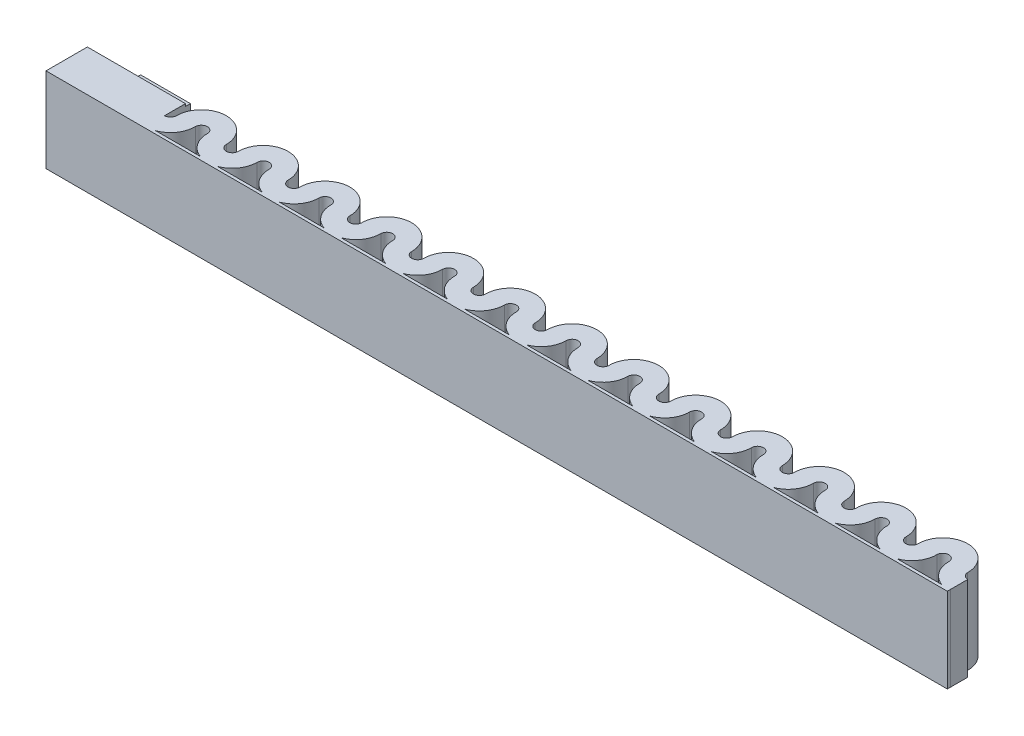
from build123d import *

# Parameters (mm, degrees)
BOSS_EXTRUDE1_DEPTH   = 15.8
BOSS_EXTRUDE1_2_DEPTH = 15.8
LPATTERN2_DEPTH       = 15.8
BOSS_EXTRUDE2_DEPTH   = 15.8
SKETCH7_W             = 19.688914994
SKETCH7_H             = 8
BOSS_EXTRUDE3_DEPTH   = 15.8
CUT_EXTRUDE1_START    = -15.8
CUT_EXTRUDE1_DEPTH    = 15.8
SKETCH9_R             = 2
CUT_EXTRUDE2_DEPTH    = 18
BOSS_EXTRUDE4_START   = 0.6
BOSS_EXTRUDE4_DEPTH   = 0.6
BOSS_EXTRUDE5_DEPTH   = 0.6
SKETCH12_W            = 180.889475192
SKETCH12_H            = 0.6
BOSS_EXTRUDE6_DEPTH   = 17
FILLET1_R             = 1
FILLET2_R             = 1
SKETCH13_W            = 10
SKETCH13_H            = 3
BOSS_EXTRUDE7_DEPTH   = 1


# Read off the part's stored shape, not the designer's step: LPattern2
with BuildPart() as part:
    # Sketch2 → Boss-Extrude1 (new body)
    with BuildSketch(Plane(origin=(0, 0, 0), x_dir=(1, 0, 0), z_dir=(0, 1, 0))):
        with BuildLine():
            Line((6.2, -1.2), (6.2, -1.8))
            ThreePointArc((6.2, -1.8), (4.927207794, -1.272792206), (4.4, 0))
            ThreePointArc((4.4, 0), (0, 4.4), (-4.4, 0))
            ThreePointArc((-4.4, 0), (-4.927207794, -1.272792206), (-6.2, -1.8))
            Line((-6.2, -1.8), (-6.2, -1.2))
            ThreePointArc((-6.2, -1.2), (-5.351471863, -0.848528137), (-5, 0))
            ThreePointArc((-5, 0), (0, 5), (5, 0))
            ThreePointArc((5, 0), (5.351471863, -0.848528137), (6.2, -1.2))
        make_face()
    extrude(amount=BOSS_EXTRUDE1_DEPTH)



with BuildPart() as body_2:
    # Sketch2 → Boss-Extrude1 2 (new body)
    with BuildSketch(Plane(origin=(0, 0, 0), x_dir=(1, 0, 0), z_dir=(0, 1, 0))):
        with BuildLine():
            Line((6.2, -4.4), (6.2, -5))
            ThreePointArc((6.2, -5), (2.664466094, -3.535533906), (1.2, 0))
            ThreePointArc((1.2, 0), (0, 1.2), (-1.2, 0))
            ThreePointArc((-1.2, 0), (-2.664466094, -3.535533906), (-6.2, -5))
            Line((-6.2, -5), (-6.2, -4.4))
            ThreePointArc((-6.2, -4.4), (-3.088730163, -3.111269837), (-1.8, 0))
            ThreePointArc((-1.8, 0), (0, 1.8), (1.8, 0))
            ThreePointArc((1.8, 0), (3.088730163, -3.111269837), (6.2, -4.4))
        make_face()
    extrude(amount=BOSS_EXTRUDE1_2_DEPTH)


with BuildPart() as part_1:
    add(part.part)

    add(body_2.part)  # LPattern2 merges body 2
    # LPattern2 outline → LPattern2 (add)
    with BuildSketch(Plane(origin=(0, 0, 0), x_dir=(1, 0, 0), z_dir=(0, 1, 0))):
        with BuildLine():
            ThreePointArc((6.2, -5), (9.735533906, -3.535533906), (11.2, 0))
            ThreePointArc((11.2, 0), (12.4, 1.2), (13.6, 0))
            ThreePointArc((13.6, 0), (18.6, -5), (23.6, 0))
            ThreePointArc((23.6, 0), (24.8, 1.2), (26, 0))
            ThreePointArc((26, 0), (31, -5), (36, 0))
            ThreePointArc((36, 0), (37.2, 1.2), (38.4, 0))
            ThreePointArc((38.4, 0), (43.4, -5), (48.4, 0))
            ThreePointArc((48.4, 0), (49.6, 1.2), (50.8, 0))
            ThreePointArc((50.8, 0), (55.8, -5), (60.8, 0))
            ThreePointArc((60.8, 0), (62, 1.2), (63.2, 0))
            ThreePointArc((63.2, 0), (68.2, -5), (73.2, 0))
            ThreePointArc((73.2, 0), (74.4, 1.2), (75.6, 0))
            ThreePointArc((75.6, 0), (80.6, -5), (85.6, 0))
            ThreePointArc((85.6, 0), (86.8, 1.2), (88, 0))
            ThreePointArc((88, 0), (93, -5), (98, 0))
            ThreePointArc((98, 0), (99.2, 1.2), (100.4, 0))
            ThreePointArc((100.4, 0), (105.4, -5), (110.4, 0))
            ThreePointArc((110.4, 0), (111.6, 1.2), (112.8, 0))
            ThreePointArc((112.8, 0), (117.8, -5), (122.8, 0))
            ThreePointArc((122.8, 0), (124, 1.2), (125.2, 0))
            ThreePointArc((125.2, 0), (130.2, -5), (135.2, 0))
            ThreePointArc((135.2, 0), (136.4, 1.2), (137.6, 0))
            ThreePointArc((137.6, 0), (142.6, -5), (147.6, 0))
            ThreePointArc((147.6, 0), (148.8, 1.2), (150, 0))
            ThreePointArc((150, 0), (151.464466094, -3.535533906), (155, -5))
            Line((155, -5), (155, -4.4))
            ThreePointArc((155, -4.4), (151.888730163, -3.111269837), (150.6, 0))
            ThreePointArc((150.6, 0), (148.8, 1.8), (147, 0))
            ThreePointArc((147, 0), (142.6, -4.4), (138.2, 0))
            ThreePointArc((138.2, 0), (136.4, 1.8), (134.6, 0))
            ThreePointArc((134.6, 0), (130.2, -4.4), (125.8, 0))
            ThreePointArc((125.8, 0), (124, 1.8), (122.2, 0))
            ThreePointArc((122.2, 0), (117.8, -4.4), (113.4, 0))
            ThreePointArc((113.4, 0), (111.6, 1.8), (109.8, 0))
            ThreePointArc((109.8, 0), (105.4, -4.4), (101, 0))
            ThreePointArc((101, 0), (99.2, 1.8), (97.4, 0))
            ThreePointArc((97.4, 0), (93, -4.4), (88.6, 0))
            ThreePointArc((88.6, 0), (86.8, 1.8), (85, 0))
            ThreePointArc((85, 0), (80.6, -4.4), (76.2, 0))
            ThreePointArc((76.2, 0), (74.4, 1.8), (72.6, 0))
            ThreePointArc((72.6, 0), (68.2, -4.4), (63.8, 0))
            ThreePointArc((63.8, 0), (62, 1.8), (60.2, 0))
            ThreePointArc((60.2, 0), (55.8, -4.4), (51.4, 0))
            ThreePointArc((51.4, 0), (49.6, 1.8), (47.8, 0))
            ThreePointArc((47.8, 0), (43.4, -4.4), (39, 0))
            ThreePointArc((39, 0), (37.2, 1.8), (35.4, 0))
            ThreePointArc((35.4, 0), (31, -4.4), (26.6, 0))
            ThreePointArc((26.6, 0), (24.8, 1.8), (23, 0))
            ThreePointArc((23, 0), (18.6, -4.4), (14.2, 0))
            ThreePointArc((14.2, 0), (12.4, 1.8), (10.6, 0))
            ThreePointArc((10.6, 0), (9.311269837, -3.111269837), (6.2, -4.4))
            Line((6.2, -4.4), (6.2, -5))
        make_face()
        with BuildLine():
            Line((155, -1.8), (155, -1.2))
            ThreePointArc((155, -1.2), (154.151471863, -0.848528137), (153.8, 0))
            ThreePointArc((153.8, 0), (148.8, 5), (143.8, 0))
            ThreePointArc((143.8, 0), (142.6, -1.2), (141.4, 0))
            ThreePointArc((141.4, 0), (136.4, 5), (131.4, 0))
            ThreePointArc((131.4, 0), (130.2, -1.2), (129, 0))
            ThreePointArc((129, 0), (124, 5), (119, 0))
            ThreePointArc((119, 0), (117.8, -1.2), (116.6, 0))
            ThreePointArc((116.6, 0), (111.6, 5), (106.6, 0))
            ThreePointArc((106.6, 0), (105.4, -1.2), (104.2, 0))
            ThreePointArc((104.2, 0), (99.2, 5), (94.2, 0))
            ThreePointArc((94.2, 0), (93, -1.2), (91.8, 0))
            ThreePointArc((91.8, 0), (86.8, 5), (81.8, 0))
            ThreePointArc((81.8, 0), (80.6, -1.2), (79.4, 0))
            ThreePointArc((79.4, 0), (74.4, 5), (69.4, 0))
            ThreePointArc((69.4, 0), (68.2, -1.2), (67, 0))
            ThreePointArc((67, 0), (62, 5), (57, 0))
            ThreePointArc((57, 0), (55.8, -1.2), (54.6, 0))
            ThreePointArc((54.6, 0), (49.6, 5), (44.6, 0))
            ThreePointArc((44.6, 0), (43.4, -1.2), (42.2, 0))
            ThreePointArc((42.2, 0), (37.2, 5), (32.2, 0))
            ThreePointArc((32.2, 0), (31, -1.2), (29.8, 0))
            ThreePointArc((29.8, 0), (24.8, 5), (19.8, 0))
            ThreePointArc((19.8, 0), (18.6, -1.2), (17.4, 0))
            ThreePointArc((17.4, 0), (12.4, 5), (7.4, 0))
            ThreePointArc((7.4, 0), (7.048528137, -0.848528137), (6.2, -1.2))
            Line((6.2, -1.2), (6.2, -1.8))
            ThreePointArc((6.2, -1.8), (7.472792206, -1.272792206), (8, 0))
            ThreePointArc((8, 0), (12.4, 4.4), (16.8, 0))
            ThreePointArc((16.8, 0), (18.6, -1.8), (20.4, 0))
            ThreePointArc((20.4, 0), (24.8, 4.4), (29.2, 0))
            ThreePointArc((29.2, 0), (31, -1.8), (32.8, 0))
            ThreePointArc((32.8, 0), (37.2, 4.4), (41.6, 0))
            ThreePointArc((41.6, 0), (43.4, -1.8), (45.2, 0))
            ThreePointArc((45.2, 0), (49.6, 4.4), (54, 0))
            ThreePointArc((54, 0), (55.8, -1.8), (57.6, 0))
            ThreePointArc((57.6, 0), (62, 4.4), (66.4, 0))
            ThreePointArc((66.4, 0), (68.2, -1.8), (70, 0))
            ThreePointArc((70, 0), (74.4, 4.4), (78.8, 0))
            ThreePointArc((78.8, 0), (80.6, -1.8), (82.4, 0))
            ThreePointArc((82.4, 0), (86.8, 4.4), (91.2, 0))
            ThreePointArc((91.2, 0), (93, -1.8), (94.8, 0))
            ThreePointArc((94.8, 0), (99.2, 4.4), (103.6, 0))
            ThreePointArc((103.6, 0), (105.4, -1.8), (107.2, 0))
            ThreePointArc((107.2, 0), (111.6, 4.4), (116, 0))
            ThreePointArc((116, 0), (117.8, -1.8), (119.6, 0))
            ThreePointArc((119.6, 0), (124, 4.4), (128.4, 0))
            ThreePointArc((128.4, 0), (130.2, -1.8), (132, 0))
            ThreePointArc((132, 0), (136.4, 4.4), (140.8, 0))
            ThreePointArc((140.8, 0), (142.6, -1.8), (144.4, 0))
            ThreePointArc((144.4, 0), (148.8, 4.4), (153.2, 0))
            ThreePointArc((153.2, 0), (153.727207794, -1.272792206), (155, -1.8))
        make_face()
    extrude(amount=LPATTERN2_DEPTH)

    # Sketch6 → Boss-Extrude2 (add)
    with BuildSketch(Plane(origin=(0, 15.8, 0), x_dir=(1, 0, 0), z_dir=(0, 1, 0))):
        Polygon((155, -1.2), (155, -5), (154.4, -4.814404083), (154.4, -1.2), align=None)
    extrude(amount=-BOSS_EXTRUDE2_DEPTH)

    # Sketch7 → Boss-Extrude3 (add)
    with BuildSketch(Plane(origin=(0, 15.8, 0), x_dir=(1, 0, 0), z_dir=(0, 1, 0))):
        with Locations((-16.044457497, -1)):
            Rectangle(SKETCH7_W, SKETCH7_H)
    extrude(amount=-BOSS_EXTRUDE3_DEPTH)

    # Sketch8 → Cut-Extrude1 (cut)
    with BuildSketch(Plane(origin=(0, 15.8, 0), x_dir=(1, 0, 0), z_dir=(0, 1, 0)).offset(CUT_EXTRUDE1_START)):
        with BuildLine():
            Line((-6.2, -1.8), (-6.2, -4.4))
            ThreePointArc((-6.2, -4.4), (-9.311269837, -3.111269837), (-10.6, 0))
            Line((-10.6, 0), (-8, 0))
            ThreePointArc((-8, 0), (-7.472792206, -1.272792206), (-6.2, -1.8))
        make_face()
    extrude(amount=CUT_EXTRUDE1_DEPTH, mode=Mode.SUBTRACT)

    # Sketch9 → Cut-Extrude2 (cut)
    with BuildSketch(Plane.ZY.offset(25.888914994)):
        with Locations((1, 7.9)):
            Circle(SKETCH9_R)
    extrude(amount=-CUT_EXTRUDE2_DEPTH, mode=Mode.SUBTRACT)

    # Sketch10 → Boss-Extrude4 (add)
    with BuildSketch(Plane.XZ.offset(BOSS_EXTRUDE4_START)):
        with BuildLine():
            Line((155, 5), (155, 1.2))
            ThreePointArc((155, 1.2), (154.151471863, 0.848528137), (153.8, 0))
            ThreePointArc((153.8, 0), (148.8, -5), (143.8, 0))
            ThreePointArc((143.8, 0), (142.6, 1.2), (141.4, 0))
            ThreePointArc((141.4, 0), (136.4, -5), (131.4, 0))
            ThreePointArc((131.4, 0), (130.2, 1.2), (129, 0))
            ThreePointArc((129, 0), (124, -5), (119, 0))
            ThreePointArc((119, 0), (117.8, 1.2), (116.6, 0))
            ThreePointArc((116.6, 0), (111.6, -5), (106.6, 0))
            ThreePointArc((106.6, 0), (105.4, 1.2), (104.2, 0))
            ThreePointArc((104.2, 0), (99.2, -5), (94.2, 0))
            ThreePointArc((94.2, 0), (93, 1.2), (91.8, 0))
            ThreePointArc((91.8, 0), (86.8, -5), (81.8, 0))
            ThreePointArc((81.8, 0), (80.6, 1.2), (79.4, 0))
            ThreePointArc((79.4, 0), (74.4, -5), (69.4, 0))
            ThreePointArc((69.4, 0), (68.2, 1.2), (67, 0))
            ThreePointArc((67, 0), (62, -5), (57, 0))
            ThreePointArc((57, 0), (55.8, 1.2), (54.6, 0))
            ThreePointArc((54.6, 0), (49.6, -5), (44.6, 0))
            ThreePointArc((44.6, 0), (43.4, 1.2), (42.2, 0))
            ThreePointArc((42.2, 0), (37.2, -5), (32.2, 0))
            ThreePointArc((32.2, 0), (31, 1.2), (29.8, 0))
            ThreePointArc((29.8, 0), (24.8, -5), (19.8, 0))
            ThreePointArc((19.8, 0), (18.6, 1.2), (17.4, 0))
            ThreePointArc((17.4, 0), (12.4, -5), (7.4, 0))
            ThreePointArc((7.4, 0), (6.2, 1.2), (5, 0))
            ThreePointArc((5, 0), (0, -5), (-5, 0))
            ThreePointArc((-5, 0), (-5.351471863, 0.848528137), (-6.2, 1.2))
            Line((-6.2, 1.2), (-6.2, -3))
            Line((-6.2, -3), (-25.888914994, -3))
            Line((-25.888914994, -3), (-25.888914994, 5))
            Line((-25.888914994, 5), (-6.2, 5))
            ThreePointArc((-6.2, 5), (-2.664466094, 3.535533906), (-1.2, 0))
            ThreePointArc((-1.2, 0), (0, -1.2), (1.2, 0))
            ThreePointArc((1.2, 0), (2.664466094, 3.535533906), (6.2, 5))
            ThreePointArc((6.2, 5), (9.735533906, 3.535533906), (11.2, 0))
            ThreePointArc((11.2, 0), (12.4, -1.2), (13.6, 0))
            ThreePointArc((13.6, 0), (18.6, 5), (23.6, 0))
            ThreePointArc((23.6, 0), (24.8, -1.2), (26, 0))
            ThreePointArc((26, 0), (31, 5), (36, 0))
            ThreePointArc((36, 0), (37.2, -1.2), (38.4, 0))
            ThreePointArc((38.4, 0), (43.4, 5), (48.4, 0))
            ThreePointArc((48.4, 0), (49.6, -1.2), (50.8, 0))
            ThreePointArc((50.8, 0), (55.8, 5), (60.8, 0))
            ThreePointArc((60.8, 0), (62, -1.2), (63.2, 0))
            ThreePointArc((63.2, 0), (68.2, 5), (73.2, 0))
            ThreePointArc((73.2, 0), (74.4, -1.2), (75.6, 0))
            ThreePointArc((75.6, 0), (80.6, 5), (85.6, 0))
            ThreePointArc((85.6, 0), (86.8, -1.2), (88, 0))
            ThreePointArc((88, 0), (93, 5), (98, 0))
            ThreePointArc((98, 0), (99.2, -1.2), (100.4, 0))
            ThreePointArc((100.4, 0), (105.4, 5), (110.4, 0))
            ThreePointArc((110.4, 0), (111.6, -1.2), (112.8, 0))
            ThreePointArc((112.8, 0), (117.8, 5), (122.8, 0))
            ThreePointArc((122.8, 0), (124, -1.2), (125.2, 0))
            ThreePointArc((125.2, 0), (130.2, 5), (135.2, 0))
            ThreePointArc((135.2, 0), (136.4, -1.2), (137.6, 0))
            ThreePointArc((137.6, 0), (142.6, 5), (147.6, 0))
            ThreePointArc((147.6, 0), (148.8, -1.2), (150, 0))
            ThreePointArc((150, 0), (151.464466094, 3.535533906), (155, 5))
        make_face()
    extrude(amount=-BOSS_EXTRUDE4_DEPTH)

    # Sketch11 → Boss-Extrude5 (add)
    with BuildSketch(Plane(origin=(0, 15.8, 0), x_dir=(1, 0, 0), z_dir=(0, 1, 0))):
        with BuildLine():
            Line((155, -5), (155, -1.2))
            ThreePointArc((155, -1.2), (154.151471863, -0.848528137), (153.8, 0))
            ThreePointArc((153.8, 0), (148.8, 5), (143.8, 0))
            ThreePointArc((143.8, 0), (142.6, -1.2), (141.4, 0))
            ThreePointArc((141.4, 0), (136.4, 5), (131.4, 0))
            ThreePointArc((131.4, 0), (130.2, -1.2), (129, 0))
            ThreePointArc((129, 0), (124, 5), (119, 0))
            ThreePointArc((119, 0), (117.8, -1.2), (116.6, 0))
            ThreePointArc((116.6, 0), (111.6, 5), (106.6, 0))
            ThreePointArc((106.6, 0), (105.4, -1.2), (104.2, 0))
            ThreePointArc((104.2, 0), (99.2, 5), (94.2, 0))
            ThreePointArc((94.2, 0), (93, -1.2), (91.8, 0))
            ThreePointArc((91.8, 0), (86.8, 5), (81.8, 0))
            ThreePointArc((81.8, 0), (80.6, -1.2), (79.4, 0))
            ThreePointArc((79.4, 0), (74.4, 5), (69.4, 0))
            ThreePointArc((69.4, 0), (68.2, -1.2), (67, 0))
            ThreePointArc((67, 0), (62, 5), (57, 0))
            ThreePointArc((57, 0), (55.8, -1.2), (54.6, 0))
            ThreePointArc((54.6, 0), (49.6, 5), (44.6, 0))
            ThreePointArc((44.6, 0), (43.4, -1.2), (42.2, 0))
            ThreePointArc((42.2, 0), (37.2, 5), (32.2, 0))
            ThreePointArc((32.2, 0), (31, -1.2), (29.8, 0))
            ThreePointArc((29.8, 0), (24.8, 5), (19.8, 0))
            ThreePointArc((19.8, 0), (18.6, -1.2), (17.4, 0))
            ThreePointArc((17.4, 0), (12.4, 5), (7.4, 0))
            ThreePointArc((7.4, 0), (6.2, -1.2), (5, 0))
            ThreePointArc((5, 0), (0, 5), (-5, 0))
            ThreePointArc((-5, 0), (-5.351471863, -0.848528137), (-6.2, -1.2))
            Line((-6.2, -1.2), (-6.2, 3))
            Line((-6.2, 3), (-25.888914994, 3))
            Line((-25.888914994, 3), (-25.888914994, -5))
            Line((-25.888914994, -5), (-6.2, -5))
            ThreePointArc((-6.2, -5), (-2.664466094, -3.535533906), (-1.2, 0))
            ThreePointArc((-1.2, 0), (0, 1.2), (1.2, 0))
            ThreePointArc((1.2, 0), (6.2, -5), (11.2, 0))
            ThreePointArc((11.2, 0), (12.4, 1.2), (13.6, 0))
            ThreePointArc((13.6, 0), (18.6, -5), (23.6, 0))
            ThreePointArc((23.6, 0), (24.8, 1.2), (26, 0))
            ThreePointArc((26, 0), (31, -5), (36, 0))
            ThreePointArc((36, 0), (37.2, 1.2), (38.4, 0))
            ThreePointArc((38.4, 0), (43.4, -5), (48.4, 0))
            ThreePointArc((48.4, 0), (49.6, 1.2), (50.8, 0))
            ThreePointArc((50.8, 0), (55.8, -5), (60.8, 0))
            ThreePointArc((60.8, 0), (62, 1.2), (63.2, 0))
            ThreePointArc((63.2, 0), (68.2, -5), (73.2, 0))
            ThreePointArc((73.2, 0), (74.4, 1.2), (75.6, 0))
            ThreePointArc((75.6, 0), (80.6, -5), (85.6, 0))
            ThreePointArc((85.6, 0), (86.8, 1.2), (88, 0))
            ThreePointArc((88, 0), (93, -5), (98, 0))
            ThreePointArc((98, 0), (99.2, 1.2), (100.4, 0))
            ThreePointArc((100.4, 0), (105.4, -5), (110.4, 0))
            ThreePointArc((110.4, 0), (111.6, 1.2), (112.8, 0))
            ThreePointArc((112.8, 0), (117.8, -5), (122.8, 0))
            ThreePointArc((122.8, 0), (124, 1.2), (125.2, 0))
            ThreePointArc((125.2, 0), (130.2, -5), (135.2, 0))
            ThreePointArc((135.2, 0), (136.4, 1.2), (137.6, 0))
            ThreePointArc((137.6, 0), (142.6, -5), (147.6, 0))
            ThreePointArc((147.6, 0), (148.8, 1.2), (150, 0))
            ThreePointArc((150, 0), (151.464466094, -3.535533906), (155, -5))
        make_face()
    extrude(amount=BOSS_EXTRUDE5_DEPTH)

    # Sketch12 → Boss-Extrude6 (add)
    with BuildSketch(Plane(origin=(0, 16.4, 0), x_dir=(1, 0, 0), z_dir=(0, 1, 0))):
        with Locations((64.555822602, -5)):
            Rectangle(SKETCH12_W, SKETCH12_H)
    extrude(amount=-BOSS_EXTRUDE6_DEPTH)

    # Fillet1
    fillet1_edges = [part_1.edges().sort_by_distance(p)[0] for p in [
        (80.6, 0, 4.4),
        (74.4, 0, -1.8),
        (93, 0, 4.4),
        (86.8, 0, -1.8),
        (105.4, 0, 4.4),
        (99.2, 0, -1.8),
        (117.8, 0, 4.4),
        (111.6, 0, -1.8),
        (130.2, 0, 4.4),
        (124, 0, -1.8),
        (142.6, 0, 4.4),
        (136.4, 0, -1.8),
        (148.8, 0, -1.8),
        (18.6, 0, 4.4),
        (12.4, 0, -1.8),
        (151.68337521, 0, 2.891366459),
        (-6.2, 0, 1.8),
        (0, 0, -4.4),
        (4.927207794, 0, 1.272792206),
        (12.4, 0, -4.4),
        (18.6, 0, 1.8),
        (24.8, 0, -4.4),
        (31, 0, 1.8),
        (37.2, 0, -4.4),
        (43.4, 0, 1.8),
        (49.6, 0, -4.4),
        (55.8, 0, 1.8),
        (62, 0, -4.4),
        (68.2, 0, 1.8),
        (74.4, 0, -4.4),
        (80.6, 0, 1.8),
        (86.8, 0, -4.4),
        (93, 0, 1.8),
        (99.2, 0, -4.4),
        (105.4, 0, 1.8),
        (111.6, 0, -4.4),
        (117.8, 0, 1.8),
        (124, 0, -4.4),
        (130.2, 0, 1.8),
        (136.4, 0, -4.4),
        (142.6, 0, 1.8),
        (148.8, 0, -4.4),
        (153.530306154, 0, 1.039230484),
        (31, 0, 4.4),
        (24.8, 0, -1.8),
        (3.088730163, 0, 3.111269837),
        (43.4, 0, 4.4),
        (0, 0, -1.8),
        (37.2, 0, -1.8),
        (-6.2, 0, 4.4),
        (55.8, 0, 4.4),
        (49.6, 0, -1.8),
        (68.2, 0, 4.4),
        (62, 0, -1.8),
    ]]
    fillet(fillet1_edges, radius=FILLET1_R)

    # Fillet2
    fillet2_edges = [part_1.edges().sort_by_distance(p)[0] for p in [
        (80.6, 15.8, 4.4),
        (74.4, 15.8, -1.8),
        (93, 15.8, 4.4),
        (86.8, 15.8, -1.8),
        (105.4, 15.8, 4.4),
        (99.2, 15.8, -1.8),
        (117.8, 15.8, 4.4),
        (111.6, 15.8, -1.8),
        (130.2, 15.8, 4.4),
        (124, 15.8, -1.8),
        (142.6, 15.8, 4.4),
        (136.4, 15.8, -1.8),
        (148.8, 15.8, -1.8),
        (151.68337521, 15.8, 2.891366459),
        (18.6, 15.8, 4.4),
        (12.4, 15.8, -1.8),
        (154.4, 15.8, 3.027977609),
        (153.530306154, 15.8, 1.039230484),
        (-6.2, 15.8, 1.8),
        (0, 15.8, -4.4),
        (4.927207794, 15.8, 1.272792206),
        (12.4, 15.8, -4.4),
        (18.6, 15.8, 1.8),
        (24.8, 15.8, -4.4),
        (31, 15.8, 1.8),
        (37.2, 15.8, -4.4),
        (43.4, 15.8, 1.8),
        (49.6, 15.8, -4.4),
        (55.8, 15.8, 1.8),
        (62, 15.8, -4.4),
        (68.2, 15.8, 1.8),
        (74.4, 15.8, -4.4),
        (80.6, 15.8, 1.8),
        (86.8, 15.8, -4.4),
        (93, 15.8, 1.8),
        (99.2, 15.8, -4.4),
        (105.4, 15.8, 1.8),
        (111.6, 15.8, -4.4),
        (117.8, 15.8, 1.8),
        (124, 15.8, -4.4),
        (130.2, 15.8, 1.8),
        (136.4, 15.8, -4.4),
        (142.6, 15.8, 1.8),
        (148.8, 15.8, -4.4),
        (-9.3, 15.8, 0),
        (31, 15.8, 4.4),
        (24.8, 15.8, -1.8),
        (43.4, 15.8, 4.4),
        (37.2, 15.8, -1.8),
        (55.8, 15.8, 4.4),
        (49.6, 15.8, -1.8),
        (3.088730163, 15.8, 3.111269837),
        (0, 15.8, -1.8),
        (-6.2, 15.8, 4.4),
        (68.2, 15.8, 4.4),
        (62, 15.8, -1.8),
    ]]
    fillet(fillet2_edges, radius=FILLET2_R)

    # Sketch13 → Boss-Extrude7 (add)
    with BuildSketch(Plane(origin=(0, 0, -3), x_dir=(-1, 0, 0), z_dir=(0, 0, -1))):
        with Locations((11.2, 14.4)):
            Rectangle(SKETCH13_W, SKETCH13_H)
        with Locations((11.2, 1.4)):
            Rectangle(SKETCH13_W, SKETCH13_H)
    extrude(amount=BOSS_EXTRUDE7_DEPTH)


solid = part_1.part
